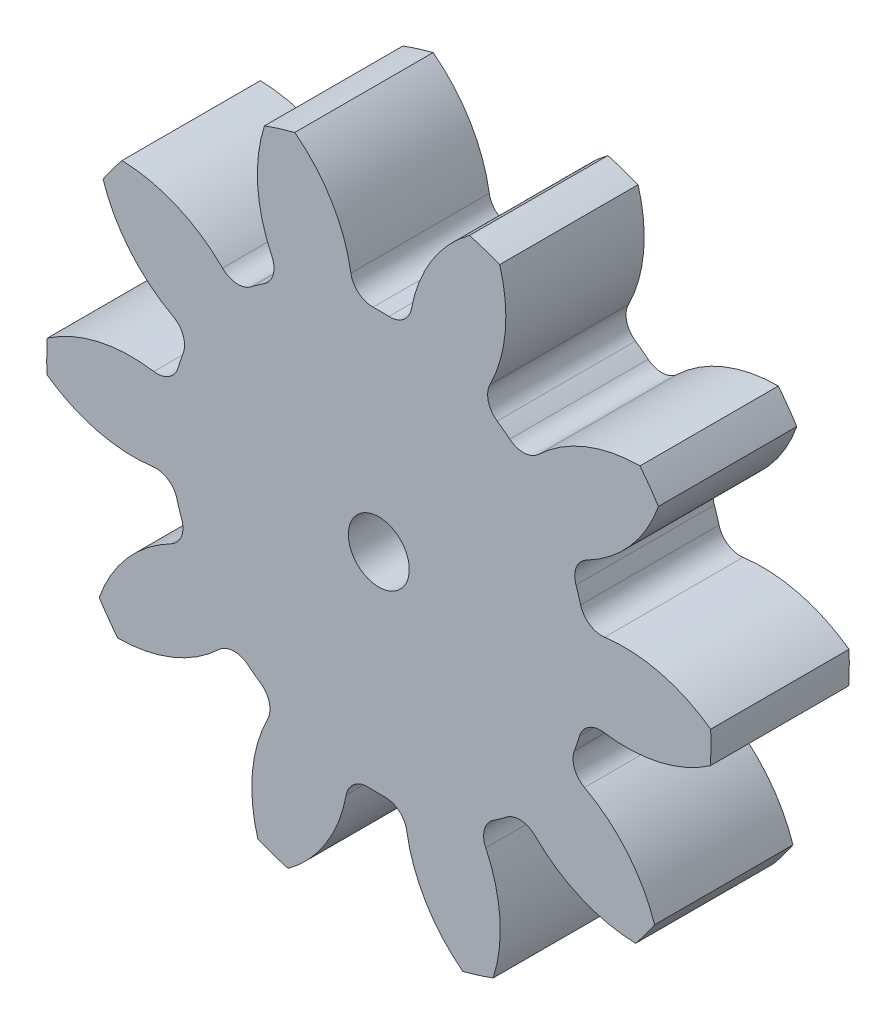
from build123d import *

# Parameters (mm, degrees)
SKETCH3_R         = 15.24
GEARBODY_DEPTH    = 6.35
TOOTHCUT_DEPTH    = 23.468593636
CIRPATTERN1_COUNT = 10
BOREDIA_R         = 1.396999992
BORE_DEPTH        = 12700


with BuildPart() as part:
    # Sketch3 → gearBody (new body)
    with BuildSketch(Plane.XY):
        Circle(SKETCH3_R)
    extrude(amount=GEARBODY_DEPTH)

    # Sketch2 → toothCut (cut, through all)
    with BuildSketch(Plane.XY):
        with BuildLine():
            ThreePointArc((8.978148959, -3.402334891), (9.099733091, -3.062335565), (9.208446704, -2.718004919))
            ThreePointArc((9.208446704, -2.718004919), (9.633677899, -2.154183003), (10.324904213, -2.009535477))
            ThreePointArc((10.324904213, -2.009535477), (14.577189645, -1.27852495), (17.531773304, 1.865794244))
            ThreePointArc((17.531773304, 1.865794244), (16.709927513, -5.623396291), (12.836674632, -12.085695996))
            ThreePointArc((12.836674632, -12.085695996), (12.384259618, -7.794818645), (9.439116174, -4.64165549))
            ThreePointArc((9.439116174, -4.64165549), (8.975980875, -4.108530348), (8.978148959, -3.402334891))
        make_face()
    toothcut = extrude(amount=TOOTHCUT_DEPTH, mode=Mode.SUBTRACT)

    # CirPattern1: toothCut ×10 about axis
    cirpattern1_axis = Axis((0, 0, 6.35), (0, 0, -1))
    for i in range(1, CIRPATTERN1_COUNT):
        add(toothcut.rotate(cirpattern1_axis, i * 360 / CIRPATTERN1_COUNT), mode=Mode.SUBTRACT)

    # boreDia → bore (cut, symmetric)
    with BuildSketch(Plane.XY):
        Circle(BOREDIA_R)
    extrude(amount=BORE_DEPTH, both=True, mode=Mode.SUBTRACT)


solid = part.part
